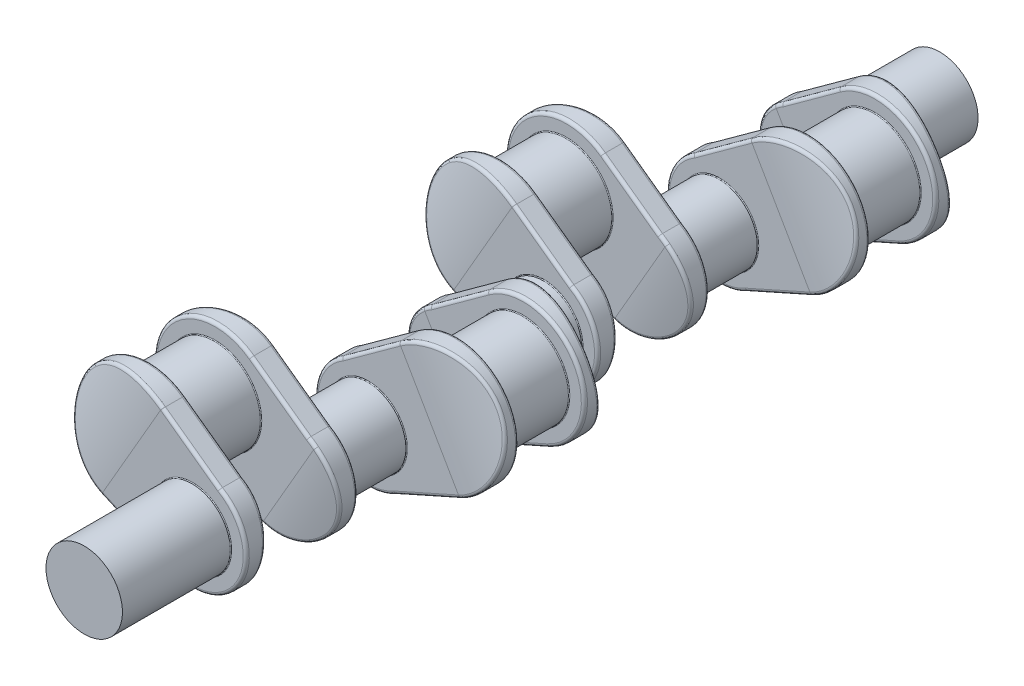
from build123d import *

# Parameters (mm, degrees)
SKETCH1_R             = 38.1
BOSS_EXTRUDE1_DEPTH   = 27.31
BOSS_EXTRUDE2_DEPTH   = 19
SKETCH3_R             = 31.75
BOSS_EXTRUDE3_DEPTH   = 26.67
CUT_EXTRUDE1_DEPTH    = 90.335
CUT_EXTRUDE2_DEPTH    = 90.335
FILLET1_R             = 2.54
FILLET2_R             = 0.64
LPATTERN1_COUNT       = 4
LPATTERN1_PITCH       = 145.96
BODY_MOVE_COPY1_ANGLE = 120
BODY_MOVE_COPY2_ANGLE = 120
BODY_MOVE_COPY3_ANGLE = 120
BODY_MOVE_COPY4_ANGLE = 120
SKETCH6_R             = 31.75
BOSS_EXTRUDE4_DEPTH   = 63.5
SKETCH7_R             = 31.75
BOSS_EXTRUDE5_DEPTH   = 63.5


with BuildPart() as part:
    # Sketch1 → Boss-Extrude1 (new body)
    with BuildSketch(Plane.XY):
        Circle(SKETCH1_R)
    extrude(amount=BOSS_EXTRUDE1_DEPTH)

    # Sketch2 → Boss-Extrude2 (add)
    with BuildSketch(Plane.XY.offset(27.31)):
        with BuildLine():
            Line((-44.45, 63.5), (-50.525695197, 5.272013362))
            ThreePointArc((-50.525695197, 5.272013362), (0, -50.8), (50.525695197, 5.272013362))
            Line((50.525695197, 5.272013362), (44.45, 63.5))
            ThreePointArc((44.45, 63.5), (0, 107.95), (-44.45, 63.5))
        make_face()
    extrude(amount=BOSS_EXTRUDE2_DEPTH)

    # Sketch3 → Boss-Extrude3 (add)
    with BuildSketch(Plane.XY.offset(46.31)):
        with Locations((0, 63.5)):
            Circle(SKETCH3_R)
    extrude(amount=BOSS_EXTRUDE3_DEPTH)

    # Sketch4 → Cut-Extrude1 (cut, symmetric)
    with BuildSketch(Plane(origin=(0, 0, 0), x_dir=(0, 0, -1), z_dir=(1, 0, 0))):
        with BuildLine():
            Line((-46.31, 5.272013362), (-58.101842179, 5.272013362))
            Line((-58.101842179, 5.272013362), (-58.101842179, -50.8))
            Line((-58.101842179, -50.8), (-36.81, -50.8))
            ThreePointArc((-36.81, -50.8), (-43.935570603, -23.166474332), (-46.31, 5.272013362))
        make_face()
    extrude(amount=CUT_EXTRUDE1_DEPTH, both=True, mode=Mode.SUBTRACT)

    # Sketch5 → Cut-Extrude2 (cut, symmetric)
    with BuildSketch(Plane(origin=(0, 0, 0), x_dir=(0, 0, -1), z_dir=(1, 0, 0))):
        with BuildLine():
            Line((-32.31, 107.95), (-14.923656436, 107.95))
            Line((-14.923656436, 107.95), (-14.923656436, 63.5))
            Line((-14.923656436, 63.5), (-27.31, 63.5))
            ThreePointArc((-27.31, 63.5), (-28.332895265, 85.891153513), (-32.31, 107.95))
        make_face()
    extrude(amount=CUT_EXTRUDE2_DEPTH, both=True, mode=Mode.SUBTRACT)

    # Fillet1
    fillet1_edges = [part.edges().sort_by_distance(p)[0] for p in [
        (-47.487847598, 34.386006681, 27.31),
        (0, -50.8, 27.31),
        (-47.487847598, 34.386006681, 46.31),
        (-50.546959134, 5.064081584, 46.31),
        (37.588258055, -34.17254537, 41.692275626),
        (50.546959134, 5.064081584, 46.31),
        (0, 107.95, 32.31),
        (47.487847598, 34.386006681, 27.31),
        (0, 107.95, 46.31),
        (47.487847598, 34.386006681, 46.31),
    ]]
    fillet(fillet1_edges, radius=FILLET1_R)

    # Fillet2
    fillet2_edges = [part.edges().sort_by_distance(p)[0] for p in [
        (-38.1, 0, 27.31),
        (-31.75, 63.5, 46.31),
    ]]
    fillet(fillet2_edges, radius=FILLET2_R)

    # Mirror1: part across plane


with BuildPart() as part_1:
    add(part.part)
    add(part.part.mirror(Plane.XY))


with BuildPart() as lpattern1_1:
    # LPattern1: pattern copy
    add(part_1.part.moved(Location(Vector(0, 0, 1) * (1 * LPATTERN1_PITCH))))


with BuildPart() as lpattern1_2:
    # LPattern1: pattern copy
    add(part_1.part.moved(Location(Vector(0, 0, 1) * (2 * LPATTERN1_PITCH))))


with BuildPart() as lpattern1_3:
    # LPattern1: pattern copy
    add(part_1.part.moved(Location(Vector(0, 0, 1) * (3 * LPATTERN1_PITCH))))


with BuildPart() as lpattern1_1_1:
    # Body-Move/Copy1: moved
    add(lpattern1_1.part.rotate(Axis((0, 63.5, 0), (0, 0, -1)), BODY_MOVE_COPY1_ANGLE))


with BuildPart() as lpattern1_3_1:
    # Body-Move/Copy2: moved
    add(lpattern1_3.part.rotate(Axis((0, 63.5, 0), (0, 0, -1)), BODY_MOVE_COPY2_ANGLE))

    # Sketch6 → Boss-Extrude4 (add)
    with BuildSketch(Plane.XY.offset(510.86)):
        with Locations((0, 63.5)):
            Circle(SKETCH6_R)
    extrude(amount=BOSS_EXTRUDE4_DEPTH)


with BuildPart() as part_2:
    # Body-Move/Copy3: moved
    add(part_1.part.rotate(Axis((0, 63.5, 0), (0, 0, 1)), BODY_MOVE_COPY3_ANGLE))

    # Sketch7 → Boss-Extrude5 (add)
    with BuildSketch(Plane(origin=(0, 0, -72.98), x_dir=(-1, 0, 0), z_dir=(0, 0, -1))):
        with Locations((0, 63.5)):
            Circle(SKETCH7_R)
    extrude(amount=BOSS_EXTRUDE5_DEPTH)


with BuildPart() as lpattern1_2_1:
    # Body-Move/Copy4: moved
    add(lpattern1_2.part.rotate(Axis((0, 63.5, 0), (0, 0, 1)), BODY_MOVE_COPY4_ANGLE))


with BuildPart() as lpattern1_3_2:
    add(lpattern1_3_1.part)

    # Combine1: union LPattern1_2, LPattern1_1, part
    add(lpattern1_2_1.part)
    add(lpattern1_1_1.part)
    add(part_2.part)


solid = lpattern1_3_2.part
